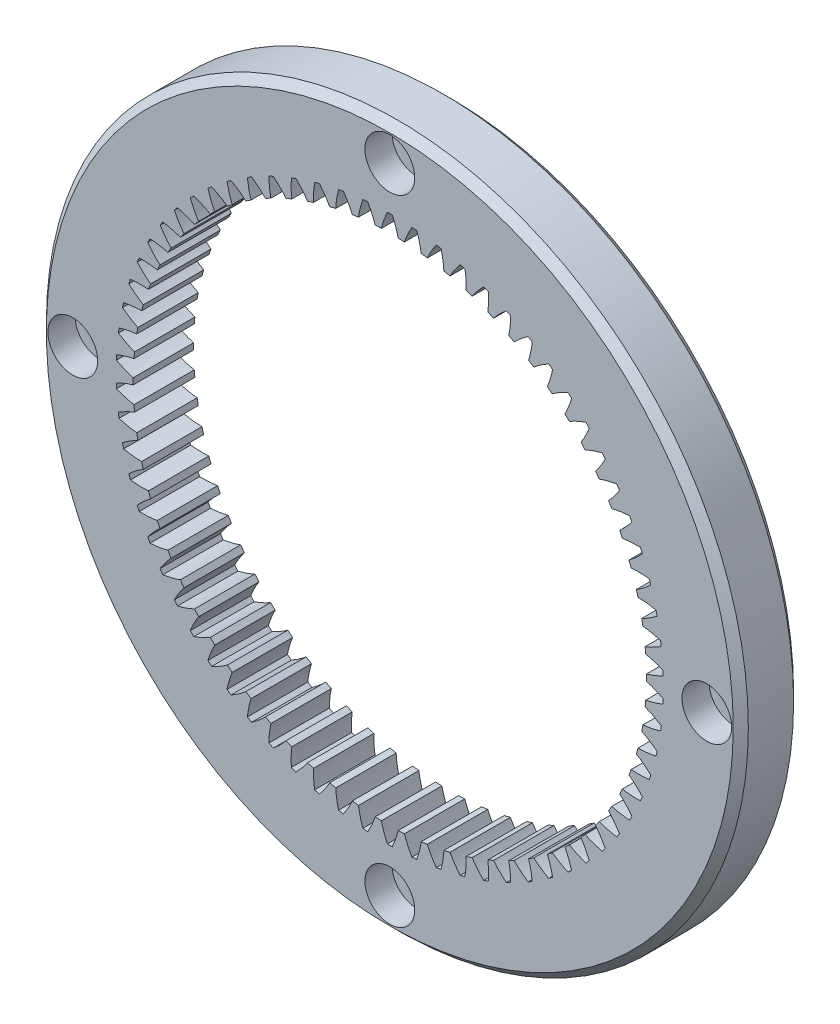
from build123d import *

# Parameters (mm, degrees)
GEAR_BASESKETCH_R                = 23.25
GEAR_BASESKETCH_R_2              = 17
F_0_5_MODULE_35_0000MM_P_D_DEPTH = 2
TOOTH_CUT_START                  = -2
TOOTH_CUT_DIN_867_DEPTH          = 4
PATTERN_CIRCULAR_1_COUNT         = 70
HOLE_WIZARD_1_D                  = 1.8
HOLE_WIZARD_1_CBORE_D            = 3.3
HOLE_WIZARD_1_CBORE_DEPTH        = 1.8
PATTERN_CIRCULAR_2_COUNT         = 4
CHAMFER_1_SIZE                   = 0.5


with BuildPart() as part:
    # Gear-BaseSketch → 0.5 Module, 35.0000mm P.D. (new, symmetric)
    with BuildSketch(Plane.XY):
        Circle(GEAR_BASESKETCH_R)
        Circle(GEAR_BASESKETCH_R_2, mode=Mode.SUBTRACT)
    extrude(amount=F_0_5_MODULE_35_0000MM_P_D_DEPTH, both=True)

    # Tooth-Sketch; Backlash: 0.0400mm → Tooth-Cut, DIN-867 (cut)
    with BuildSketch(Plane.XY.offset(TOOTH_CUT_START)):
        with BuildLine():
            Line((0, 0), (0.556184022, 16.990899309))
            add(Edge.make_bspline(
                [(0.556184022, 16.990899309), (0.551720652, 17.010171809), (0.542570965, 17.049679481), (0.527475233, 17.110137547), (0.510877157, 17.173269292), (0.49262278, 17.239024892), (0.472661627, 17.307376439), (0.450914324, 17.378287811), (0.427310547, 17.45172332), (0.401778261, 17.527645271), (0.374246653, 17.606014597), (0.344645978, 17.686790986), (0.312905107, 17.769931713), (0.278962185, 17.855396486), (0.242722723, 17.943128467), (0.204223789, 18.033128606), (0.177140306, 18.093584588), (0.163396568, 18.124263476)],
                knots=[0, 0, 0, 0, 0.049395374, 0.101258075, 0.155588104, 0.21238546, 0.271650144, 0.333382155, 0.397581494, 0.464248161, 0.533382155, 0.604983477, 0.679052127, 0.755588104, 0.834591408, 0.91606204, 1, 1, 1, 1], degree=3))
            ThreePointArc((0.163396568, 18.124263476), (0, 18.125), (-0.163396568, 18.124263476))
            add(Edge.make_bspline(
                [(-0.556184022, 16.990899309), (-0.551720652, 17.010171809), (-0.542570965, 17.049679481), (-0.527475233, 17.110137547), (-0.510877157, 17.173269292), (-0.49262278, 17.239024892), (-0.472661627, 17.307376439), (-0.450914324, 17.378287811), (-0.427310547, 17.45172332), (-0.401778261, 17.527645271), (-0.374246653, 17.606014597), (-0.344645978, 17.686790986), (-0.312905107, 17.769931713), (-0.278962185, 17.855396486), (-0.242722723, 17.943128467), (-0.204223789, 18.033128606), (-0.177140306, 18.093584588), (-0.163396568, 18.124263476)],
                knots=[0, 0, 0, 0, 0.049395374, 0.101258075, 0.155588104, 0.21238546, 0.271650144, 0.333382155, 0.397581494, 0.464248161, 0.533382155, 0.604983477, 0.679052127, 0.755588104, 0.834591408, 0.91606204, 1, 1, 1, 1], degree=3))
            Line((-0.556184022, 16.990899309), (0, 0))
        make_face()
    tooth_cut_din_867 = extrude(amount=TOOTH_CUT_DIN_867_DEPTH, mode=Mode.SUBTRACT)

    # 阵列(圆周)1: Tooth-Cut, DIN-867 ×70 about axis
    pattern_circular_1_axis = Axis((0, 0, 2), (0, 0, -1))
    for i in range(1, PATTERN_CIRCULAR_1_COUNT):
        add(tooth_cut_din_867.rotate(pattern_circular_1_axis, i * 360 / PATTERN_CIRCULAR_1_COUNT), mode=Mode.SUBTRACT)

    # 打孔尺寸(%根据)内六角圆柱头螺钉的类型1 (through all)
    with Locations(Plane(origin=(0, 21, 2), x_dir=(1, 0, 0), z_dir=(0, 0, 1))):
        with Locations((0, 0)):
            hole_wizard_1 = CounterBoreHole(HOLE_WIZARD_1_D / 2, HOLE_WIZARD_1_CBORE_D / 2, HOLE_WIZARD_1_CBORE_DEPTH)

    # 阵列(圆周)2: 打孔尺寸(%根据)内六角圆柱头螺钉的类型1 ×4 about axis
    pattern_circular_2_axis = Axis((0, 0, 0), (0, 0, 1))
    for i in range(1, PATTERN_CIRCULAR_2_COUNT):
        add(hole_wizard_1.rotate(pattern_circular_2_axis, i * 360 / PATTERN_CIRCULAR_2_COUNT), mode=Mode.SUBTRACT)

    # 倒角1
    chamfer_1_edges = [part.edges().sort_by_distance(p)[0] for p in [
        (-23.25, 0, -2),
        (-23.25, 0, 2),
    ]]
    chamfer(chamfer_1_edges, length=CHAMFER_1_SIZE)


solid = part.part
